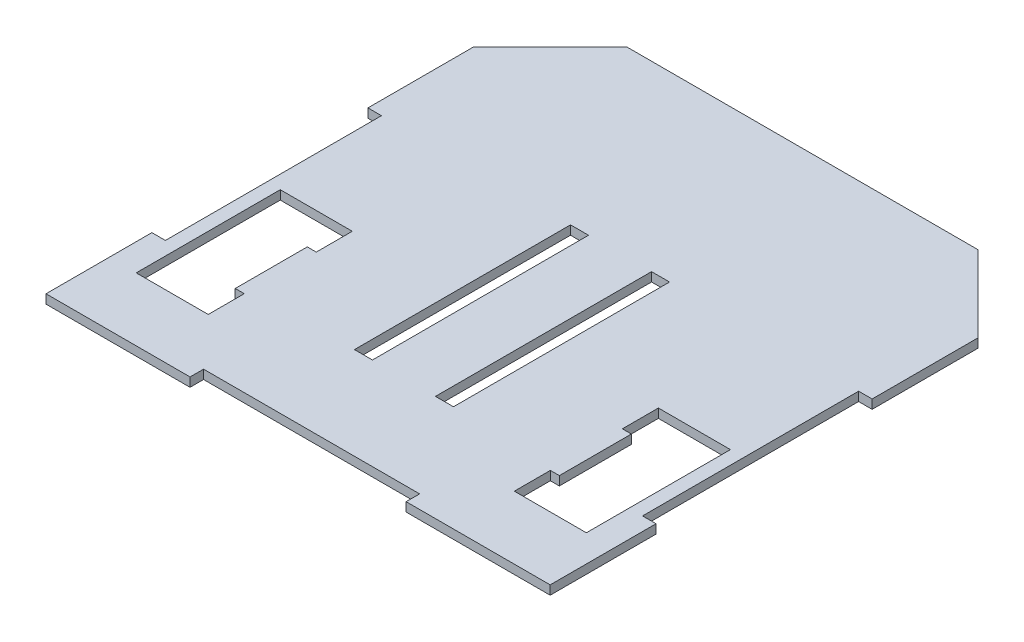
from build123d import *

# Parameters (mm, degrees)
BOSS_EXTRUDE1_DEPTH = 6.35
SKETCH4_W           = 38.1
SKETCH4_H           = 101.6
CUT_EXTRUDE3_DEPTH  = 252.527339468
SKETCH5_W           = 12.7
SKETCH5_H           = 25.4
CUT_EXTRUDE4_DEPTH  = 252.527339468
SKETCH6_W           = 6.35
SKETCH6_H           = 50.8
CUT_EXTRUDE5_DEPTH  = 252.527339468
SKETCH13_W          = 12.7
SKETCH13_H          = 152.4
CUT_EXTRUDE8_DEPTH  = 252.527339468


with BuildPart() as part:
    # Sketch1 → Boss-Extrude1 (new body)
    with BuildSketch(Plane(origin=(0, 0, 0), x_dir=(1, 0, 0), z_dir=(0, 1, 0))):
        Polygon((-177.8, 123.952), (-123.952, 177.8), (123.952, 177.8), (177.8, 123.952), (177.8, 49.276), (168.275, 49.276), (168.275, -103.124), (177.8, -103.124), (177.8, -177.8), (76.2, -177.8), (76.2, -168.275), (-76.2, -168.275), (-76.2, -177.8), (-177.8, -177.8), (-177.8, -103.124), (-168.275, -103.124), (-168.275, 49.276), (-177.8, 49.276), align=None)
    extrude(amount=BOSS_EXTRUDE1_DEPTH)

    # Sketch4 → Cut-Extrude3 (cut, through all)
    with BuildSketch(Plane(origin=(0, 6.35, 0), x_dir=(1, 0, 0), z_dir=(0, 1, 0))):
        with Locations((139.7, -82.423)):
            Rectangle(SKETCH4_W, SKETCH4_H)
        with Locations((-139.7, -82.423)):
            Rectangle(SKETCH4_W, SKETCH4_H)
    extrude(amount=-CUT_EXTRUDE3_DEPTH, mode=Mode.SUBTRACT)

    # Sketch5 → Cut-Extrude4 (cut, through all)
    with BuildSketch(Plane(origin=(0, 6.35, 0), x_dir=(1, 0, 0), z_dir=(0, 1, 0))):
        with Locations((114.3, -120.523)):
            Rectangle(SKETCH5_W, SKETCH5_H)
        with Locations((114.3, -44.323)):
            Rectangle(SKETCH5_W, SKETCH5_H)
        with Locations((-114.3, -44.323)):
            Rectangle(SKETCH5_W, SKETCH5_H)
        with Locations((-114.3, -120.523)):
            Rectangle(SKETCH5_W, SKETCH5_H)
    extrude(amount=-CUT_EXTRUDE4_DEPTH, mode=Mode.SUBTRACT)

    # Sketch6 → Cut-Extrude5 (cut, through all)
    with BuildSketch(Plane(origin=(0, 6.35, 0), x_dir=(1, 0, 0), z_dir=(0, 1, 0))):
        with Locations((117.475, -82.423)):
            Rectangle(SKETCH6_W, SKETCH6_H)
        with Locations((-117.475, -82.423)):
            Rectangle(SKETCH6_W, SKETCH6_H)
    extrude(amount=-CUT_EXTRUDE5_DEPTH, mode=Mode.SUBTRACT)

    # Sketch13 → Cut-Extrude8 (cut, through all)
    with BuildSketch(Plane(origin=(0, 6.35, 0), x_dir=(1, 0, 0), z_dir=(0, 1, 0))):
        with Locations((-28.575, -26.924)):
            Rectangle(SKETCH13_W, SKETCH13_H)
        with Locations((28.575, -26.924)):
            Rectangle(SKETCH13_W, SKETCH13_H)
    extrude(amount=-CUT_EXTRUDE8_DEPTH, mode=Mode.SUBTRACT)


solid = part.part
